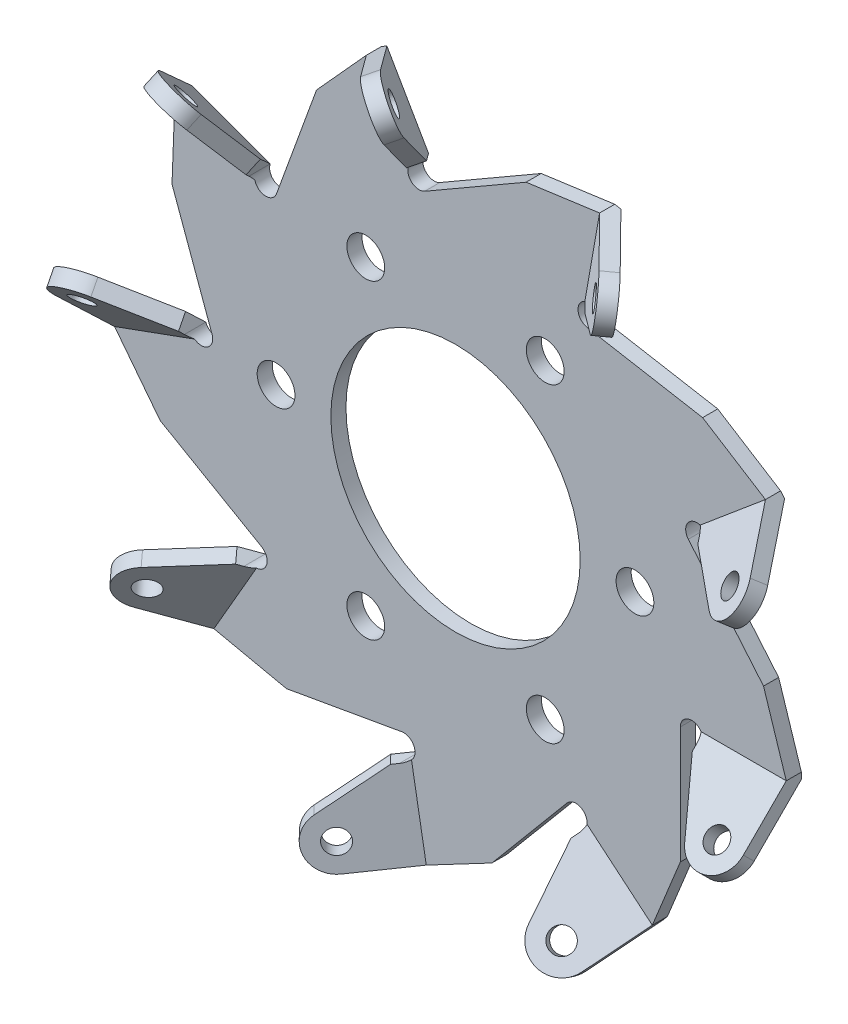
from build123d import *

# Parameters (mm, degrees)
SKETCH_7_R                          = 1.5
EXTRUDE_3_DEPTH                     = 2
PATTERN_CIRCULAR_1_COUNT            = 9
SKETCH_2_R                          = 50
SKETCH_2_R_2                        = 16.5
SKETCH_2_R_3                        = 2.5
EXTRUDE_1_DEPTH                     = 2
EXTRUDE_2_DEPTH                     = 2
SKETCH_4_R                          = 50
SKETCH_4_R_2                        = 46.106662127
CUT_EXTRUDE_1_DEPTH                 = 2
PATTERN_CIRCULAR_4_COUNT            = 9
OTHER_START                         = 25
OTHER_3_DEPTH                       = 9
CUT_EXTRUDE_4_REACH                 = 86.785
PATTERN_CIRCULAR_15_COUNT           = 9
CHAMFER_2_SIZE                      = 2
CUT_EXTRUDE_6_REACH                 = 86.785
PATTERN_CIRCULAR_17_COUNT           = 9
CUT_EXTRUDE_7_REACH                 = 86.785
PATTERN_CIRCULAR_19_COUNT           = 9
SKETCH_15_R                         = 8.026911935
CUT_EXTRUDE_9_DEPTH                 = 93.567160054
CUT_EXTRUDE_9_DRAFT                 = -5
PATTERN_CIRCULAR_26_COPY_1_SKETCH_R = 8.026911935
PATTERN_CIRCULAR_26_COPY_1_DEPTH    = 93.567160054
PATTERN_CIRCULAR_26_COPY_1_DRAFT    = -5
PATTERN_CIRCULAR_26_COPY_2_SKETCH_R = 8.026911935
PATTERN_CIRCULAR_26_COPY_2_DEPTH    = 93.567160054
PATTERN_CIRCULAR_26_COPY_2_DRAFT    = -5
PATTERN_CIRCULAR_26_COPY_3_SKETCH_R = 8.026911935
PATTERN_CIRCULAR_26_COPY_3_DEPTH    = 93.567160054
PATTERN_CIRCULAR_26_COPY_3_DRAFT    = -5
PATTERN_CIRCULAR_26_COPY_4_SKETCH_R = 8.026911935
PATTERN_CIRCULAR_26_COPY_4_DEPTH    = 93.567160054
PATTERN_CIRCULAR_26_COPY_4_DRAFT    = -5
PATTERN_CIRCULAR_26_COPY_5_SKETCH_R = 8.026911935
PATTERN_CIRCULAR_26_COPY_5_DEPTH    = 93.567160054
PATTERN_CIRCULAR_26_COPY_5_DRAFT    = -5
PATTERN_CIRCULAR_26_COPY_6_SKETCH_R = 8.026911935
PATTERN_CIRCULAR_26_COPY_6_DEPTH    = 93.567160054
PATTERN_CIRCULAR_26_COPY_6_DRAFT    = -5
PATTERN_CIRCULAR_26_COPY_7_SKETCH_R = 8.026911935
PATTERN_CIRCULAR_26_COPY_7_DEPTH    = 93.567160054
PATTERN_CIRCULAR_26_COPY_7_DRAFT    = -5
PATTERN_CIRCULAR_26_COPY_8_SKETCH_R = 8.026911935
PATTERN_CIRCULAR_26_COPY_8_DEPTH    = 93.567160054
PATTERN_CIRCULAR_26_COPY_8_DRAFT    = -5
SKETCH_14_R                         = 1.5
CUT_EXTRUDE_8_DEPTH                 = 82.855397957
PATTERN_CIRCULAR_27_COUNT           = 9
OTHER_START_2                       = 14
OTHER_4_OUTLINE_R                   = 2.5
OTHER_4_OUTLINE_R_2                 = 16.5
OTHER_4_DEPTH                       = 11


with BuildPart() as part:
    # ｽｹｯﾁ1 → 回転1 (revolve)
    with BuildSketch(Plane(origin=(0, 0, 0), x_dir=(-1, 0, 0), z_dir=(0, 0.7071067811865488, 0.7071067811865464))):
        with BuildLine():
            Line((-47.157979176, 23.5), (-40.275, 23.5))
            Line((-40.275, 23.5), (-40.275, -23.5))
            Line((-40.275, -23.5), (-47.157979176, -23.5))
            add(Edge.make_bspline(
                [(-47.157979176, 23.5), (-53.013297933, 0), (-47.157979176, -23.5)],
                knots=[4.373605266, 4.373605266, 4.373605266, 5.051172695, 5.051172695, 5.051172695], degree=2, weights=[1, 0.943159584, 1]))
        make_face()
    revolve(axis=Axis((40.275, -16.617009358, 16.617009358), (0, 0.7071067811865462, -0.7071067811865489)))

    # ｽｹｯﾁ7 → ﾎﾞｽ - 押し出し3 (add)
    with BuildSketch(Plane(origin=(0, -16.617009358, 16.617009358), x_dir=(1, 0, 0), z_dir=(0, -0.7071067811865462, 0.7071067811865488))):
        with Locations(Location((40.275, 0, 0), (0, 0, 270))):
            Circle(SKETCH_7_R)
    extrude_3 = extrude(amount=EXTRUDE_3_DEPTH)

    # ﾐﾗｰ1: ﾎﾞｽ - 押し出し3 across plane
    add(extrude_3.mirror(Plane(origin=(0, 0, 0), x_dir=(0, 0.7071067811865488, 0.7071067811865464), z_dir=(0, -0.7071067811865462, 0.7071067811865488))))


with BuildPart() as pattern_circular_1_1:
    # 円形ﾊﾟﾀｰﾝ1: pattern copy
    add(part.part.rotate(Axis((0, 0, -25.842985085), (0, 0, 1)), 1 * 360 / PATTERN_CIRCULAR_1_COUNT))


with BuildPart() as pattern_circular_1_2:
    # 円形ﾊﾟﾀｰﾝ1: pattern copy
    add(part.part.rotate(Axis((0, 0, -25.842985085), (0, 0, 1)), 2 * 360 / PATTERN_CIRCULAR_1_COUNT))


with BuildPart() as pattern_circular_1_3:
    # 円形ﾊﾟﾀｰﾝ1: pattern copy
    add(part.part.rotate(Axis((0, 0, -25.842985085), (0, 0, 1)), 3 * 360 / PATTERN_CIRCULAR_1_COUNT))


with BuildPart() as pattern_circular_1_4:
    # 円形ﾊﾟﾀｰﾝ1: pattern copy
    add(part.part.rotate(Axis((0, 0, -25.842985085), (0, 0, 1)), 4 * 360 / PATTERN_CIRCULAR_1_COUNT))


with BuildPart() as pattern_circular_1_5:
    # 円形ﾊﾟﾀｰﾝ1: pattern copy
    add(part.part.rotate(Axis((0, 0, -25.842985085), (0, 0, 1)), 5 * 360 / PATTERN_CIRCULAR_1_COUNT))


with BuildPart() as pattern_circular_1_6:
    # 円形ﾊﾟﾀｰﾝ1: pattern copy
    add(part.part.rotate(Axis((0, 0, -25.842985085), (0, 0, 1)), 6 * 360 / PATTERN_CIRCULAR_1_COUNT))


with BuildPart() as pattern_circular_1_7:
    # 円形ﾊﾟﾀｰﾝ1: pattern copy
    add(part.part.rotate(Axis((0, 0, -25.842985085), (0, 0, 1)), 7 * 360 / PATTERN_CIRCULAR_1_COUNT))


with BuildPart() as pattern_circular_1_8:
    # 円形ﾊﾟﾀｰﾝ1: pattern copy
    add(part.part.rotate(Axis((0, 0, -25.842985085), (0, 0, 1)), 8 * 360 / PATTERN_CIRCULAR_1_COUNT))


with BuildPart() as body_10:
    # ｽｹｯﾁ2 → ﾎﾞｽ - 押し出し1 (new body)
    with BuildSketch(Plane.XY.offset(25)):
        Circle(SKETCH_2_R)
        Circle(SKETCH_2_R_2, mode=Mode.SUBTRACT)
        with Locations((-23.75, 0)):
            Circle(SKETCH_2_R_3, mode=Mode.SUBTRACT)
        with Locations((-11.875, 20.56810334)):
            Circle(SKETCH_2_R_3, mode=Mode.SUBTRACT)
        with Locations((11.875, 20.56810334)):
            Circle(SKETCH_2_R_3, mode=Mode.SUBTRACT)
        with Locations((23.75, 0)):
            Circle(SKETCH_2_R_3, mode=Mode.SUBTRACT)
        with Locations((11.875, -20.56810334)):
            Circle(SKETCH_2_R_3, mode=Mode.SUBTRACT)
        with Locations((-11.875, -20.56810334)):
            Circle(SKETCH_2_R_3, mode=Mode.SUBTRACT)
    extrude(amount=-EXTRUDE_1_DEPTH)

    # ｽｹｯﾁ3 → ﾎﾞｽ - 押し出し2 (add)
    with BuildSketch(Plane(origin=(0, -17.324116139, 17.324116139), x_dir=(1, 0, 0), z_dir=(0, -0.7071067811865462, 0.7071067811865488))):
        with BuildLine():
            Line((37.243911087, -1.75), (24.686542732, 20))
            Line((24.686542732, 20), (43.775, 20))
            Line((43.775, 20), (43.775, 0))
            ThreePointArc((43.775, 0), (41.180866658, -3.380740392), (37.243911087, -1.75))
        make_face()
    extrude_2 = extrude(amount=EXTRUDE_2_DEPTH)

    # ｽｹｯﾁ4 → ｶｯﾄ - 押し出し1 (cut)
    with BuildSketch(Plane.XY.offset(25)):
        Circle(SKETCH_4_R)
        Circle(SKETCH_4_R_2, mode=Mode.SUBTRACT)
    extrude(amount=-CUT_EXTRUDE_1_DEPTH, mode=Mode.SUBTRACT)

    # 円形ﾊﾟﾀｰﾝ4: ﾎﾞｽ - 押し出し2 ×9 about axis
    pattern_circular_4_axis = Axis((0, 0, 0), (0, 0, 1))
    for i in range(1, PATTERN_CIRCULAR_4_COUNT):
        add(extrude_2.rotate(pattern_circular_4_axis, i * 360 / PATTERN_CIRCULAR_4_COUNT))

    # Combine 1: union part, 円形ﾊﾟﾀｰﾝ1_1, 円形ﾊﾟﾀｰﾝ1_2, 円形ﾊﾟﾀｰﾝ1_3, 円形ﾊﾟﾀｰﾝ1_4, 円形ﾊﾟﾀｰﾝ1_6, 円形ﾊﾟﾀｰﾝ1_5, 円形ﾊﾟﾀｰﾝ1_8, 円形ﾊﾟﾀｰﾝ1_7
    add(part.part)
    add(pattern_circular_1_1.part)
    add(pattern_circular_1_2.part)
    add(pattern_circular_1_3.part)
    add(pattern_circular_1_4.part)
    add(pattern_circular_1_6.part)
    add(pattern_circular_1_5.part)
    add(pattern_circular_1_8.part)
    add(pattern_circular_1_7.part)

    # 交差3: read off the stored shape, not the designer's step
    # 交差3 outline → 交差3 (cut)
    with BuildSketch(Plane.XY.offset(OTHER_START)):
        Polygon((43.775, -15.932797006), (43.775, 15.932797006), (41.553437572, 18.58035201), (35.578933147, 25.700489122), (23.292190994, 40.343258223), (19.888559889, 40.943410219), (10.735088059, 42.55741427), (-8.08929304, 45.876660553), (-11.082396003, 44.148591752), (-19.131824039, 39.501252308), (-35.685706961, 29.943863546), (-36.867775638, 26.696156547), (-40.046743043, 17.962015384), (-46.58438199, 0), (-45.402313312, -3.247707001), (-42.223345907, -11.981848164), (-35.685706961, -29.943863547), (-32.692603997, -31.671932349), (-8.089293042, -45.876660554), (-4.685661934, -45.276508557), (4.467809896, -43.662504506), (23.292190995, -40.343258223), (25.513753423, -37.695703218), (31.488257848, -30.575566106), align=None)
    extrude(amount=OTHER_3_DEPTH, mode=Mode.SUBTRACT)

    # ｽｹｯﾁ9 → ｶｯﾄ - 押し出し4 (cut, up to next)
    with BuildSketch(Plane.XY.offset(25), mode=Mode.PRIVATE) as cut_extrude_4_sk1:
        with BuildLine():
            Line((43.775, -14.476659403), (32.753908888, -14.476659403))
            Line((32.753908888, -14.476659403), (32.753908888, -32.45005))
            ThreePointArc((32.753908888, -32.45005), (39.30558696, -24.101766039), (43.775, -14.476659403))
        make_face()
    cut_extrude_4_tool1 = extrude(cut_extrude_4_sk1.sketch, amount=-CUT_EXTRUDE_4_REACH, mode=Mode.PRIVATE) & body_10.part
    # ｽｹｯﾁ9 → ｶｯﾄ - 押し出し4 (cut, up to next)
    with BuildSketch(Plane.XY.offset(25), mode=Mode.PRIVATE) as cut_extrude_4_sk2:
        with BuildLine():
            Line((43.775, 14.476659403), (43.775, -14.476659403))
            ThreePointArc((43.775, -14.476659403), (45.520014428, -7.331615029), (46.106662127, 0))
            ThreePointArc((46.106662127, 0), (45.520014428, 7.331615029), (43.775, 14.476659403))
        make_face()
    cut_extrude_4_tool2 = extrude(cut_extrude_4_sk2.sketch, amount=-CUT_EXTRUDE_4_REACH, mode=Mode.PRIVATE) & body_10.part
    cut_extrude_4_1 = cut_extrude_4_tool1.solids().sort_by_distance((36.761282, -20.949139, 25))[0]
    add(cut_extrude_4_1, mode=Mode.SUBTRACT)
    cut_extrude_4_2 = cut_extrude_4_tool2.solids().sort_by_distance((44.709716, 0, 25))[0]
    add(cut_extrude_4_2, mode=Mode.SUBTRACT)
    cut_extrude_4 = cut_extrude_4_1 + cut_extrude_4_2  # ｶｯﾄ - 押し出し4 as one shape, for the pattern or mirror that repeats it

    # 円形ﾊﾟﾀｰﾝ15: ｶｯﾄ - 押し出し4 ×9 about axis
    pattern_circular_15_axis = Axis((0, 0, 0), (0, 0, 1))
    for i in range(1, PATTERN_CIRCULAR_15_COUNT):
        add(cut_extrude_4.rotate(pattern_circular_15_axis, i * 360 / PATTERN_CIRCULAR_15_COUNT), mode=Mode.SUBTRACT)

    # 面取り2
    chamfer_2_edges = [body_10.edges().sort_by_distance(p)[0] for p in [
        (-40.908134603, 0.516395821, 25),
        (-31.669382027, -25.899659909, 25),
        (-7.612173634, -40.196976925, 25),
        (20.006855402, -35.685681698, 25),
        (38.264454444, -14.476659403, 25),
        (38.61768999, 13.506152717, 25),
        (20.901279201, 35.169285877, 25),
        (-6.595072417, 40.376319312, 25),
        (-31.005516356, 26.690824208, 25),
    ]]
    chamfer(chamfer_2_edges, length=CHAMFER_2_SIZE - 0.0001)  # a hair under: the kernel refuses the full size

    # ｽｹｯﾁ11 → ｶｯﾄ - 押し出し6 (cut, up to next)
    with BuildSketch(Plane.XY.offset(25), mode=Mode.PRIVATE) as cut_extrude_6_sk1:
        with BuildLine():
            Line((-5.571850447, 34.604046872), (11.892264826, 44.686958525))
            ThreePointArc((11.892264826, 44.686958525), (13.941302931, 44.137920419), (13.392264826, 42.088882314))
            Line((13.392264826, 42.088882314), (-4.071850447, 32.00597066))
            ThreePointArc((-4.071850447, 32.00597066), (-6.120888552, 32.555008766), (-5.571850447, 34.604046872))
        make_face()
    cut_extrude_6_tool1 = extrude(cut_extrude_6_sk1.sketch, amount=-CUT_EXTRUDE_6_REACH, mode=Mode.PRIVATE) & body_10.part
    cut_extrude_6 = cut_extrude_6_tool1.solids().sort_by_distance((3.910207, 38.346465, 25))[0]
    add(cut_extrude_6, mode=Mode.SUBTRACT)

    # 円形ﾊﾟﾀｰﾝ17: ｶｯﾄ - 押し出し6 ×9 about axis
    pattern_circular_17_axis = Axis((0, 0, 0), (0, 0, 1))
    for i in range(1, PATTERN_CIRCULAR_17_COUNT):
        add(cut_extrude_6.rotate(pattern_circular_17_axis, i * 360 / PATTERN_CIRCULAR_17_COUNT), mode=Mode.SUBTRACT)

    # ｽｹｯﾁ13 → ｶｯﾄ - 押し出し7 (cut, up to next)
    with BuildSketch(Plane.XY.offset(25), mode=Mode.PRIVATE) as cut_extrude_7_sk1:
        Polygon((19.072718434, 41.08726508), (13.392264826, 42.088882314), (9.338467933, 39.748421587), align=None)
    cut_extrude_7_tool1 = extrude(cut_extrude_7_sk1.sketch, amount=-CUT_EXTRUDE_7_REACH, mode=Mode.PRIVATE) & body_10.part
    cut_extrude_7 = cut_extrude_7_tool1.solids().sort_by_distance((13.934484, 40.974856, 25))[0]
    add(cut_extrude_7, mode=Mode.SUBTRACT)

    # 円形ﾊﾟﾀｰﾝ19: ｶｯﾄ - 押し出し7 ×9 about axis
    pattern_circular_19_axis = Axis((0, 0, 0), (0, 0, 1))
    for i in range(1, PATTERN_CIRCULAR_19_COUNT):
        add(cut_extrude_7.rotate(pattern_circular_19_axis, i * 360 / PATTERN_CIRCULAR_19_COUNT), mode=Mode.SUBTRACT)


with BuildPart() as cut_extrude_9_tool:
    # ｽｹｯﾁ15 → ｶｯﾄ - 押し出し9 (with draft: the straight prism first)
    with BuildSketch(Plane(origin=(0, -17.324116139, 17.324116139), x_dir=(1, 0, 0), z_dir=(0, 0.7071067811865462, -0.7071067811865488))):
        with Locations((40.275, 0)):
            Circle(SKETCH_15_R)
    extrude(amount=CUT_EXTRUDE_9_DEPTH)
    # ｶｯﾄ - 押し出し9: the draft: its side faces are tilted about the plane it starts from
    cut_extrude_9_sides = [cut_extrude_9_tool.faces().sort_by_distance(p)[0] for p in [
        (32.248088065, 15.756870546, -15.756870546),
    ]]
    draft(cut_extrude_9_sides, Plane(origin=(0, -17.324116139, 17.324116139), x_dir=(1, 0, 0), z_dir=(0, 0.7071067811865462, -0.7071067811865488)), CUT_EXTRUDE_9_DRAFT)


with BuildPart() as body_10_1:
    add(body_10.part)

    # ｶｯﾄ - 押し出し9: cut by cut_extrude_9_tool
    add(cut_extrude_9_tool.part, mode=Mode.SUBTRACT)


with BuildPart() as pattern_circular_26_copy_1_tool:
    # 円形ﾊﾟﾀｰﾝ26 copy 1 sketch → 円形ﾊﾟﾀｰﾝ26 copy 1 (with draft: the straight prism first)
    with BuildSketch(Plane(origin=(11.135727203, -13.2710429, 17.324116139), x_dir=(0.766044443118978, 0.6427876096865393, 0), z_dir=(-0.4545194776720428, 0.5416752204197008, -0.7071067811865488))):
        with Locations((40.275, 0)):
            Circle(PATTERN_CIRCULAR_26_COPY_1_SKETCH_R)
    extrude(amount=PATTERN_CIRCULAR_26_COPY_1_DEPTH)
    # 円形ﾊﾟﾀｰﾝ26 copy 1: the draft: its side faces are tilted about the plane it starts from
    pattern_circular_26_copy_1_sides = [pattern_circular_26_copy_1_tool.faces().sort_by_distance(p)[0] for p in [
        (14.575147509, 32.799134567, -15.756870546),
    ]]
    draft(pattern_circular_26_copy_1_sides, Plane(origin=(11.135727203, -13.2710429, 17.324116139), x_dir=(0.766044443118978, 0.6427876096865393, 0), z_dir=(-0.4545194776720428, 0.5416752204197008, -0.7071067811865488)), PATTERN_CIRCULAR_26_COPY_1_DRAFT)


with BuildPart() as body_10_2:
    add(body_10_1.part)

    # 円形ﾊﾟﾀｰﾝ26 copy 1: cut by pattern_circular_26_copy_1_tool
    add(pattern_circular_26_copy_1_tool.part, mode=Mode.SUBTRACT)


with BuildPart() as pattern_circular_26_copy_2_tool:
    # 円形ﾊﾟﾀｰﾝ26 copy 2 sketch → 円形ﾊﾟﾀｰﾝ26 copy 2 (with draft: the straight prism first)
    with BuildSketch(Plane(origin=(17.060923888, -3.008301197, 17.324116139), x_dir=(0.17364817766693041, 0.984807753012208, 0), z_dir=(-0.6963642403200176, 0.12278780396897267, -0.7071067811865488))):
        with Locations((40.275, 0)):
            Circle(PATTERN_CIRCULAR_26_COPY_2_SKETCH_R)
    extrude(amount=PATTERN_CIRCULAR_26_COPY_2_DEPTH)
    # 円形ﾊﾟﾀｰﾝ26 copy 2: the draft: its side faces are tilted about the plane it starts from
    pattern_circular_26_copy_2_sides = [pattern_circular_26_copy_2_tool.faces().sort_by_distance(p)[0] for p in [
        (-9.917666551, 34.494319002, -15.756870546),
    ]]
    draft(pattern_circular_26_copy_2_sides, Plane(origin=(17.060923888, -3.008301197, 17.324116139), x_dir=(0.17364817766693041, 0.984807753012208, 0), z_dir=(-0.6963642403200176, 0.12278780396897267, -0.7071067811865488)), PATTERN_CIRCULAR_26_COPY_2_DRAFT)


with BuildPart() as body_10_3:
    add(body_10_2.part)

    # 円形ﾊﾟﾀｰﾝ26 copy 2: cut by pattern_circular_26_copy_2_tool
    add(pattern_circular_26_copy_2_tool.part, mode=Mode.SUBTRACT)


with BuildPart() as pattern_circular_26_copy_3_tool:
    # 円形ﾊﾟﾀｰﾝ26 copy 3 sketch → 円形ﾊﾟﾀｰﾝ26 copy 3 (with draft: the straight prism first)
    with BuildSketch(Plane(origin=(15.003124675, 8.66205807, 17.324116139), x_dir=(-0.4999999999999998, 0.8660254037844387, 0), z_dir=(-0.6123724356957935, -0.35355339059327295, -0.7071067811865488))):
        with Locations((40.275, 0)):
            Circle(PATTERN_CIRCULAR_26_COPY_3_SKETCH_R)
    extrude(amount=PATTERN_CIRCULAR_26_COPY_3_DEPTH)
    # 円形ﾊﾟﾀｰﾝ26 copy 3: the draft: its side faces are tilted about the plane it starts from
    pattern_circular_26_copy_3_sides = [pattern_circular_26_copy_3_tool.faces().sort_by_distance(p)[0] for p in [
        (-29.769894209, 20.049228215, -15.756870546),
    ]]
    draft(pattern_circular_26_copy_3_sides, Plane(origin=(15.003124675, 8.66205807, 17.324116139), x_dir=(-0.4999999999999998, 0.8660254037844387, 0), z_dir=(-0.6123724356957935, -0.35355339059327295, -0.7071067811865488)), PATTERN_CIRCULAR_26_COPY_3_DRAFT)


with BuildPart() as body_10_4:
    add(body_10_3.part)

    # 円形ﾊﾟﾀｰﾝ26 copy 3: cut by pattern_circular_26_copy_3_tool
    add(pattern_circular_26_copy_3_tool.part, mode=Mode.SUBTRACT)


with BuildPart() as pattern_circular_26_copy_4_tool:
    # 円形ﾊﾟﾀｰﾝ26 copy 4 sketch → 円形ﾊﾟﾀｰﾝ26 copy 4 (with draft: the straight prism first)
    with BuildSketch(Plane(origin=(5.925196685, 16.279344098, 17.324116139), x_dir=(-0.9396926207859083, 0.3420201433256689, 0), z_dir=(-0.24184476264797491, -0.6644630243886734, -0.7071067811865488))):
        with Locations((40.275, 0)):
            Circle(PATTERN_CIRCULAR_26_COPY_4_SKETCH_R)
    extrude(amount=PATTERN_CIRCULAR_26_COPY_4_DEPTH)
    # 円形ﾊﾟﾀｰﾝ26 copy 4: the draft: its side faces are tilted about the plane it starts from
    pattern_circular_26_copy_4_sides = [pattern_circular_26_copy_4_tool.faces().sort_by_distance(p)[0] for p in [
        (-35.692457512, -3.777119277, -15.756870546),
    ]]
    draft(pattern_circular_26_copy_4_sides, Plane(origin=(5.925196685, 16.279344098, 17.324116139), x_dir=(-0.9396926207859083, 0.3420201433256689, 0), z_dir=(-0.24184476264797491, -0.6644630243886734, -0.7071067811865488)), PATTERN_CIRCULAR_26_COPY_4_DRAFT)


with BuildPart() as body_10_5:
    add(body_10_4.part)

    # 円形ﾊﾟﾀｰﾝ26 copy 4: cut by pattern_circular_26_copy_4_tool
    add(pattern_circular_26_copy_4_tool.part, mode=Mode.SUBTRACT)


with BuildPart() as pattern_circular_26_copy_5_tool:
    # 円形ﾊﾟﾀｰﾝ26 copy 5 sketch → 円形ﾊﾟﾀｰﾝ26 copy 5 (with draft: the straight prism first)
    with BuildSketch(Plane(origin=(-5.925196685, 16.279344098, 17.324116139), x_dir=(-0.9396926207859084, -0.34202014332566866, 0), z_dir=(0.24184476264797478, -0.6644630243886736, -0.7071067811865488))):
        with Locations((40.275, 0)):
            Circle(PATTERN_CIRCULAR_26_COPY_5_SKETCH_R)
    extrude(amount=PATTERN_CIRCULAR_26_COPY_5_DEPTH)
    # 円形ﾊﾟﾀｰﾝ26 copy 5: the draft: its side faces are tilted about the plane it starts from
    pattern_circular_26_copy_5_sides = [pattern_circular_26_copy_5_tool.faces().sort_by_distance(p)[0] for p in [
        (-24.914123267, -25.836110681, -15.756870546),
    ]]
    draft(pattern_circular_26_copy_5_sides, Plane(origin=(-5.925196685, 16.279344098, 17.324116139), x_dir=(-0.9396926207859084, -0.34202014332566866, 0), z_dir=(0.24184476264797478, -0.6644630243886736, -0.7071067811865488)), PATTERN_CIRCULAR_26_COPY_5_DRAFT)


with BuildPart() as body_10_6:
    add(body_10_5.part)

    # 円形ﾊﾟﾀｰﾝ26 copy 5: cut by pattern_circular_26_copy_5_tool
    add(pattern_circular_26_copy_5_tool.part, mode=Mode.SUBTRACT)


with BuildPart() as pattern_circular_26_copy_6_tool:
    # 円形ﾊﾟﾀｰﾝ26 copy 6 sketch → 円形ﾊﾟﾀｰﾝ26 copy 6 (with draft: the straight prism first)
    with BuildSketch(Plane(origin=(-15.003124675, 8.66205807, 17.324116139), x_dir=(-0.5000000000000004, -0.8660254037844384, 0), z_dir=(0.6123724356957932, -0.35355339059327345, -0.7071067811865488))):
        with Locations((40.275, 0)):
            Circle(PATTERN_CIRCULAR_26_COPY_6_SKETCH_R)
    extrude(amount=PATTERN_CIRCULAR_26_COPY_6_DEPTH)
    # 円形ﾊﾟﾀｰﾝ26 copy 6: the draft: its side faces are tilted about the plane it starts from
    pattern_circular_26_copy_6_sides = [pattern_circular_26_copy_6_tool.faces().sort_by_distance(p)[0] for p in [
        (-2.478193856, -35.806098761, -15.756870546),
    ]]
    draft(pattern_circular_26_copy_6_sides, Plane(origin=(-15.003124675, 8.66205807, 17.324116139), x_dir=(-0.5000000000000004, -0.8660254037844384, 0), z_dir=(0.6123724356957932, -0.35355339059327345, -0.7071067811865488)), PATTERN_CIRCULAR_26_COPY_6_DRAFT)


with BuildPart() as body_10_7:
    add(body_10_6.part)

    # 円形ﾊﾟﾀｰﾝ26 copy 6: cut by pattern_circular_26_copy_6_tool
    add(pattern_circular_26_copy_6_tool.part, mode=Mode.SUBTRACT)


with BuildPart() as pattern_circular_26_copy_7_tool:
    # 円形ﾊﾟﾀｰﾝ26 copy 7 sketch → 円形ﾊﾟﾀｰﾝ26 copy 7 (with draft: the straight prism first)
    with BuildSketch(Plane(origin=(-17.060923888, -3.008301197, 17.324116139), x_dir=(0.17364817766692997, -0.9848077530122081, 0), z_dir=(0.6963642403200178, 0.12278780396897236, -0.7071067811865488))):
        with Locations((40.275, 0)):
            Circle(PATTERN_CIRCULAR_26_COPY_7_SKETCH_R)
    extrude(amount=PATTERN_CIRCULAR_26_COPY_7_DEPTH)
    # 円形ﾊﾟﾀｰﾝ26 copy 7: the draft: its side faces are tilted about the plane it starts from
    pattern_circular_26_copy_7_sides = [pattern_circular_26_copy_7_tool.faces().sort_by_distance(p)[0] for p in [
        (21.117310003, -29.02201529, -15.756870546),
    ]]
    draft(pattern_circular_26_copy_7_sides, Plane(origin=(-17.060923888, -3.008301197, 17.324116139), x_dir=(0.17364817766692997, -0.9848077530122081, 0), z_dir=(0.6963642403200178, 0.12278780396897236, -0.7071067811865488)), PATTERN_CIRCULAR_26_COPY_7_DRAFT)


with BuildPart() as body_10_8:
    add(body_10_7.part)

    # 円形ﾊﾟﾀｰﾝ26 copy 7: cut by pattern_circular_26_copy_7_tool
    add(pattern_circular_26_copy_7_tool.part, mode=Mode.SUBTRACT)


with BuildPart() as pattern_circular_26_copy_8_tool:
    # 円形ﾊﾟﾀｰﾝ26 copy 8 sketch → 円形ﾊﾟﾀｰﾝ26 copy 8 (with draft: the straight prism first)
    with BuildSketch(Plane(origin=(-11.135727203, -13.2710429, 17.324116139), x_dir=(0.7660444431189778, -0.6427876096865396, 0), z_dir=(0.45451947767204304, 0.5416752204197007, -0.7071067811865488))):
        with Locations((40.275, 0)):
            Circle(PATTERN_CIRCULAR_26_COPY_8_SKETCH_R)
    extrude(amount=PATTERN_CIRCULAR_26_COPY_8_DEPTH)
    # 円形ﾊﾟﾀｰﾝ26 copy 8: the draft: its side faces are tilted about the plane it starts from
    pattern_circular_26_copy_8_sides = [pattern_circular_26_copy_8_tool.faces().sort_by_distance(p)[0] for p in [
        (34.831789818, -8.658208322, -15.756870546),
    ]]
    draft(pattern_circular_26_copy_8_sides, Plane(origin=(-11.135727203, -13.2710429, 17.324116139), x_dir=(0.7660444431189778, -0.6427876096865396, 0), z_dir=(0.45451947767204304, 0.5416752204197007, -0.7071067811865488)), PATTERN_CIRCULAR_26_COPY_8_DRAFT)


with BuildPart() as body_10_9:
    add(body_10_8.part)

    # 円形ﾊﾟﾀｰﾝ26 copy 8: cut by pattern_circular_26_copy_8_tool
    add(pattern_circular_26_copy_8_tool.part, mode=Mode.SUBTRACT)

    # ｽｹｯﾁ14 → ｶｯﾄ - 押し出し8 (cut, through all)
    with BuildSketch(Plane(origin=(0, -18.738329701, 18.738329701), x_dir=(1, 0, 0), z_dir=(0, -0.7071067811865462, 0.7071067811865488))):
        with Locations(Location((40.275, 0, 0), (0, 0, 270))):
            Circle(SKETCH_14_R)
    cut_extrude_8 = extrude(amount=-CUT_EXTRUDE_8_DEPTH, mode=Mode.SUBTRACT)

    # 円形ﾊﾟﾀｰﾝ27: ｶｯﾄ - 押し出し8 ×9 about axis
    pattern_circular_27_axis = Axis((0, 0, -25.842985085), (0, 0, 1))
    for i in range(1, PATTERN_CIRCULAR_27_COUNT):
        add(cut_extrude_8.rotate(pattern_circular_27_axis, i * 360 / PATTERN_CIRCULAR_27_COUNT), mode=Mode.SUBTRACT)

    # ﾐﾗｰ2: body 10 across plane


with BuildPart() as body_10_10:
    add(body_10_9.part)
    add(body_10_9.part.mirror(Plane.XY.offset(25)))

    # 交差4: read off the stored shape, not the designer's step
    # 交差4 outline → 交差4 (cut)
    with BuildSketch(Plane.XY.offset(OTHER_START_2)):
        with BuildLine():
            Line((21.488829339, -42.492420955), (26.046256114, -37.061091223))
            Line((26.046256114, -37.061091223), (29.753908888, -27.961561256))
            Line((29.753908888, -27.961561256), (29.753908888, -12.476659403))
            ThreePointArc((29.753908888, -12.476659403), (31.253908888, -10.976659403), (32.753908888, -12.476659403))
            Line((32.753908888, -12.476659403), (32.753908888, -48))
            Line((32.753908888, -48), (43.775, -48))
            Line((43.775, -48), (43.775, -11.648232278))
            Line((43.775, -11.648232278), (40.766161688, -2.294354648))
            Line((40.766161688, -2.294354648), (30.812658639, 9.567768369))
            ThreePointArc((30.812658639, 9.567768369), (30.997543889, 11.681016448), (33.110791968, 11.496131198))
            Line((33.110791968, 11.496131198), (34.396367188, 9.964042311))
            Line((34.396367188, 9.964042311), (48, -6.248135965))
            Line((48, -6.248135965), (48, 10.897638077))
            Line((48, 10.897638077), (45.578361656, 13.783634273))
            Line((45.578361656, 13.783634273), (41.020934881, 19.214964005))
            Line((41.020934881, 19.214964005), (32.703474368, 24.446405998))
            Line((32.703474368, 24.446405998), (17.453822969, 27.135330987))
            ThreePointArc((17.453822969, 27.135330987), (16.237083605, 28.873014883), (17.974767502, 30.089754246))
            Line((17.974767502, 30.089754246), (19.944383008, 29.74245789))
            Line((19.944383008, 29.74245789), (48, 24.795495644))
            Line((48, 24.795495644), (48, 35.986604861))
            Line((48, 35.986604861), (26.055101346, 39.856082583))
            Line((26.055101346, 39.856082583), (19.072718434, 41.08726508))
            Line((19.072718434, 41.08726508), (9.338467933, 39.748421587))
            Line((9.338467933, 39.748421587), (-4.071850447, 32.00597066))
            ThreePointArc((-4.071850447, 32.00597066), (-6.120888552, 32.555008766), (-5.571850447, 34.604046872))
            Line((-5.571850447, 34.604046872), (-3.839799639, 35.604046872))
            Line((-3.839799639, 35.604046872), (19.3626718, 49))
            Line((19.3626718, 49), (-2.679510428, 49))
            Line((-2.679510428, 49), (-5.659630454, 47.279426901))
            Line((-5.659630454, 47.279426901), (-11.799834938, 43.73437819))
            Line((-11.799834938, 43.73437819), (-18.396111433, 36.45170896))
            Line((-18.396111433, 36.45170896), (-23.692259784, 21.900660955))
            ThreePointArc((-23.692259784, 21.900660955), (-25.61482893, 21.004152239), (-26.511337647, 22.926721385))
            Line((-26.511337647, 22.926721385), (-25.82729736, 24.806106627))
            Line((-25.82729736, 24.806106627), (-17.021440319, 49))
            Line((-17.021440319, 49), (-28.749840511, 49))
            Line((-28.749840511, 49), (-34.726158265, 32.58020192))
            Line((-34.726158265, 32.58020192), (-37.151114402, 25.917689691))
            Line((-37.151114402, 25.917689691), (-37.52294581, 16.098836596))
            Line((-37.52294581, 16.098836596), (-32.226797459, 1.547788591))
            ThreePointArc((-32.226797459, 1.547788591), (-33.123306175, -0.374780556), (-35.045875321, 0.521728161))
            Line((-35.045875321, 0.521728161), (-35.729915608, 2.401113402))
            Line((-35.729915608, 2.401113402), (-49, 38.860370594))
            Line((-49, 38.860370594), (-49, 6.636855936))
            Line((-49, 6.636855936), (-47.543930685, 2.636338372))
            Line((-47.543930685, 2.636338372), (-45.118974548, -4.026173857))
            Line((-45.118974548, -4.026173857), (-39.092376821, -11.786860331))
            Line((-39.092376821, -11.786860331), (-25.682058441, -19.529311257))
            ThreePointArc((-25.682058441, -19.529311257), (-25.133020336, -21.578349363), (-27.182058441, -22.127387469))
            Line((-27.182058441, -22.127387469), (-28.914109249, -21.127387469))
            Line((-28.914109249, -21.127387469), (-49, -9.53079304))
            Line((-49, -9.53079304), (-49, -22.256852877))
            Line((-49, -22.256852877), (-38.115369546, -28.5410972))
            Line((-38.115369546, -28.5410972), (-31.975165062, -32.086145912))
            Line((-31.975165062, -32.086145912), (-22.370050255, -34.157354312))
            Line((-22.370050255, -34.157354312), (-7.120398855, -31.468429324))
            ThreePointArc((-7.120398855, -31.468429324), (-5.382714959, -32.685168687), (-6.599454322, -34.422852583))
            Line((-6.599454322, -34.422852583), (-8.569069828, -34.770148938))
            Line((-8.569069828, -34.770148938), (-49, -41.899212776))
            Line((-49, -41.899212776), (-49, -48))
            Line((-49, -48), (-20.131349444, -48))
            Line((-20.131349444, -48), (-10.852203391, -46.363836193))
            Line((-10.852203391, -46.363836193), (-3.869820479, -45.132653696))
            Line((-3.869820479, -45.132653696), (4.819471442, -40.545242594))
            Line((4.819471442, -40.545242594), (14.77297449, -28.683119577))
            ThreePointArc((14.77297449, -28.683119577), (16.886222569, -28.498234327), (17.07110782, -30.611482406))
            Line((17.07110782, -30.611482406), (15.7855326, -32.143571292))
            Line((15.7855326, -32.143571292), (2.480409111, -48))
            Line((2.480409111, -48), (16.867421794, -48))
            Line((16.867421794, -48), (21.488829339, -42.492420955))
        make_face()
        with Locations((-11.875, -20.56810334)):
            Circle(OTHER_4_OUTLINE_R, mode=Mode.SUBTRACT)
        with Locations((-23.75, 0)):
            Circle(OTHER_4_OUTLINE_R, mode=Mode.SUBTRACT)
        with Locations((11.875, -20.56810334)):
            Circle(OTHER_4_OUTLINE_R, mode=Mode.SUBTRACT)
        Circle(OTHER_4_OUTLINE_R_2, mode=Mode.SUBTRACT)
        with Locations((23.75, 0)):
            Circle(OTHER_4_OUTLINE_R, mode=Mode.SUBTRACT)
        with Locations((-11.875, 20.56810334)):
            Circle(OTHER_4_OUTLINE_R, mode=Mode.SUBTRACT)
        with Locations((11.875, 20.56810334)):
            Circle(OTHER_4_OUTLINE_R, mode=Mode.SUBTRACT)
    extrude(amount=OTHER_4_DEPTH, mode=Mode.SUBTRACT)


solid = body_10_10.part
